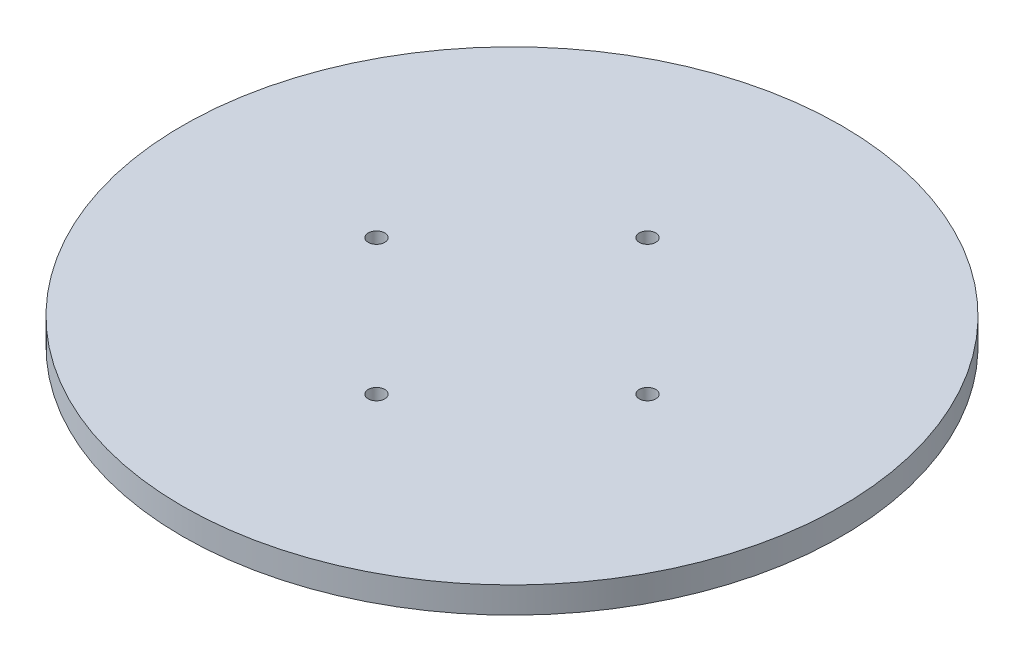
from build123d import *

# Parameters (mm, degrees)
SKETCH1_R           = 40
BOSS_EXTRUDE1_DEPTH = 1.5875
SKETCH2_R           = 1
CUT_EXTRUDE2_DEPTH  = 57.657573413


with BuildPart() as part:
    # Sketch1 → Boss-Extrude1 (new, symmetric)
    with BuildSketch(Plane(origin=(0, 0, 0), x_dir=(1, 0, 0), z_dir=(0, 1, 0))):
        Circle(SKETCH1_R)
    extrude(amount=BOSS_EXTRUDE1_DEPTH, both=True)

    # Sketch2 → Cut-Extrude2 (cut, through all)
    with BuildSketch(Plane.XZ.offset(1.5875)):
        with Locations((-16.45, 0)):
            Circle(SKETCH2_R)
        with Locations((0, -16.45)):
            Circle(SKETCH2_R)
        with Locations((0, 16.45)):
            Circle(SKETCH2_R)
        with Locations((16.45, 0)):
            Circle(SKETCH2_R)
    extrude(amount=-CUT_EXTRUDE2_DEPTH, mode=Mode.SUBTRACT)


solid = part.part
